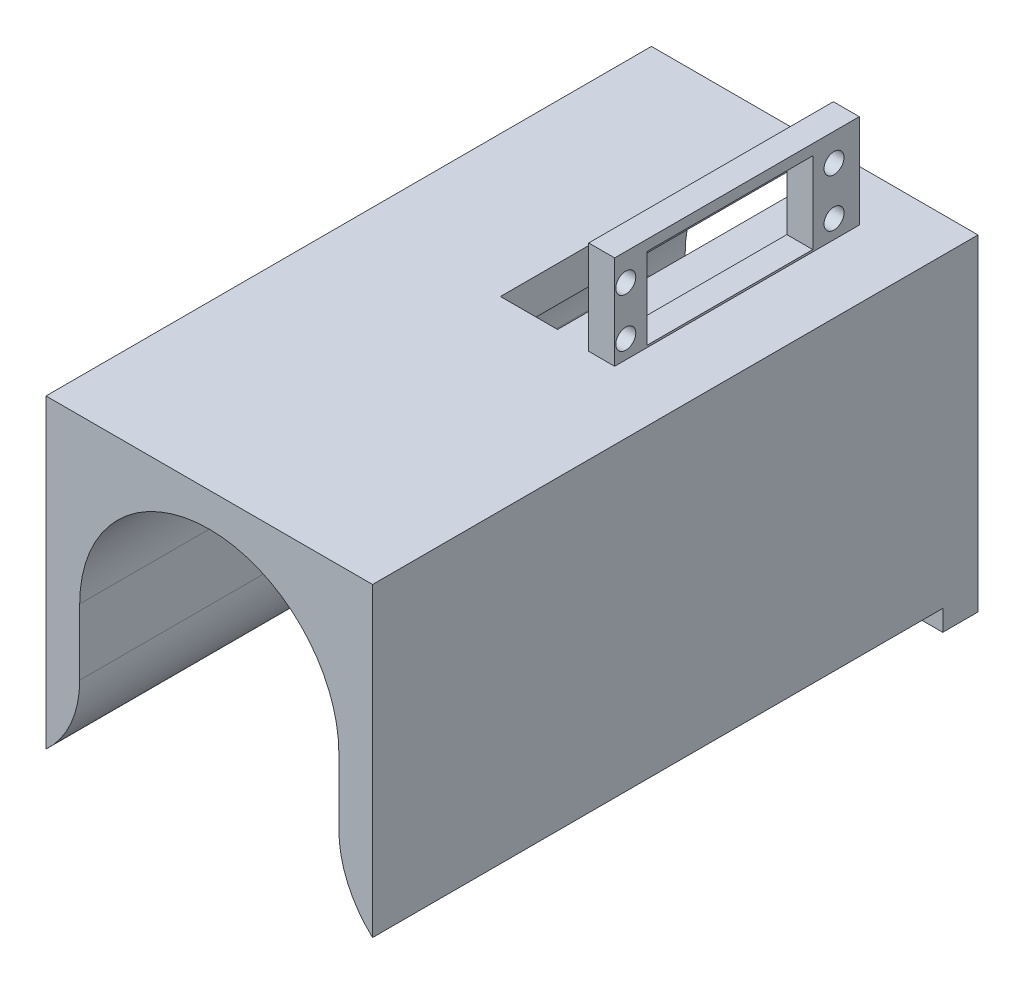
from build123d import *

# Parameters (mm, degrees)
SKETCH1_W           = 80.01
SKETCH1_H           = 80.01
BOSS_EXTRUDE1_DEPTH = 2.54
SKETCH2_W           = 80.01
SKETCH2_H           = 80.01
SKETCH2_W_2         = 69.85
SKETCH2_H_2         = 69.85
BOSS_EXTRUDE2_DEPTH = 145.796
SKETCH3_R           = 31.75
CUT_EXTRUDE1_DEPTH  = 69.85
SKETCH5_W           = 80.01
SKETCH5_H           = 139.7
CUT_EXTRUDE3_DEPTH  = 5.08
SKETCH6_W           = 69.85
SKETCH6_H           = 69.85
SKETCH6_R           = 31.75
BOSS_EXTRUDE3_DEPTH = 145.796
CUT_EXTRUDE5_START  = -139.7
CUT_EXTRUDE5_DEPTH  = 139.7
FILLET2_R           = 25.4
SKETCH9_W           = 6.35
SKETCH9_H           = 59.944
BOSS_EXTRUDE5_DEPTH = 23
SKETCH10_R          = 2.45
SKETCH10_W          = 40.6
SKETCH10_H          = 19.9
CUT_EXTRUDE7_DEPTH  = 23
SKETCH12_W          = 14
SKETCH12_H          = 72
CUT_EXTRUDE10_DEPTH = 24.13


with BuildPart() as part:
    # Sketch1 → Boss-Extrude1 (new body)
    with BuildSketch(Plane.XY):
        Rectangle(SKETCH1_W, SKETCH1_H)
    extrude(amount=BOSS_EXTRUDE1_DEPTH)

    # Sketch2 → Boss-Extrude2 (add)
    with BuildSketch(Plane.XY.offset(2.54)):
        Rectangle(SKETCH2_W, SKETCH2_H)
        Rectangle(SKETCH2_W_2, SKETCH2_H_2, mode=Mode.SUBTRACT)
    extrude(amount=BOSS_EXTRUDE2_DEPTH)

    # Sketch3 → Cut-Extrude1 (cut)
    with BuildSketch(Plane(origin=(0, 0, 0), x_dir=(-1, 0, 0), z_dir=(0, 0, -1))):
        Circle(SKETCH3_R)
    extrude(amount=-CUT_EXTRUDE1_DEPTH, mode=Mode.SUBTRACT)

    # Sketch5 → Cut-Extrude3 (cut)
    with BuildSketch(Plane.XZ.offset(40.005)):
        with Locations((0, 78.486)):
            Rectangle(SKETCH5_W, SKETCH5_H)
    extrude(amount=-CUT_EXTRUDE3_DEPTH, mode=Mode.SUBTRACT)

    # Sketch6 → Boss-Extrude3 (add)
    with BuildSketch(Plane.XY.offset(2.54)):
        Rectangle(SKETCH6_W, SKETCH6_H)
        with Locations(Location((0, 0, 0), (0, 0, 180))):
            Circle(SKETCH6_R, mode=Mode.SUBTRACT)
    extrude(amount=BOSS_EXTRUDE3_DEPTH)

    # Sketch8 → Cut-Extrude5 (cut)
    with BuildSketch(Plane.XY.offset(148.336).offset(CUT_EXTRUDE5_START)):
        with BuildLine():
            ThreePointArc((31.75, 0), (0, -31.75), (-31.75, 0))
            Line((-31.75, 0), (-31.75, -34.925))
            Line((-31.75, -34.925), (31.75, -34.925))
            Line((31.75, -34.925), (31.75, 0))
        make_face()
    extrude(amount=CUT_EXTRUDE5_DEPTH, mode=Mode.SUBTRACT)

    # Fillet2
    # the kernel refuses this fillet: 25.4 mm, written as the material it takes off along each edge
    with BuildSketch(Plane(origin=(31.75, -34.925, 8.636), x_dir=(1, 0, 0), z_dir=(0, 0, 1))) as fillet2_piece_1:
        with BuildLine():
            CenterArc((25.4, 18.740570295), FILLET2_R, 180, 47.545849796)
            Line((0, 18.740570295), (0, 0))
            Line((0, 0), (8.255, 0))
        make_face()
    extrude(amount=186.551425739, mode=Mode.SUBTRACT)
    with BuildSketch(Plane(origin=(-31.75, -34.925, 8.636), x_dir=(0, 1, 0), z_dir=(0, 0, 1))) as fillet2_piece_2:
        with BuildLine():
            CenterArc((18.740570295, 25.4), FILLET2_R, 222.454150204, 47.545849796)
            Line((0, 8.255), (0, 0))
            Line((0, 0), (18.740570295, 0))
        make_face()
    extrude(amount=186.551425739, mode=Mode.SUBTRACT)

    # Sketch9 → Boss-Extrude5 (add)
    with BuildSketch(Plane(origin=(0, 40.005, 0), x_dir=(1, 0, 0), z_dir=(0, 1, 0))):
        with Locations((20.193, -42.418)):
            Rectangle(SKETCH9_W, SKETCH9_H)
    extrude(amount=BOSS_EXTRUDE5_DEPTH)

    # Sketch10 → Cut-Extrude7 (cut)
    with BuildSketch(Plane(origin=(23.368, 0, 0), x_dir=(0, 0, -1), z_dir=(1, 0, 0))):
        with Locations((-69.659214709, 44.502596375)):
            Circle(SKETCH10_R)
        with Locations((-69.659214709, 56.402596375)):
            Circle(SKETCH10_R)
        with Locations((-18.639214709, 44.502596375)):
            Circle(SKETCH10_R)
        with Locations((-18.639214709, 56.244452771)):
            Circle(SKETCH10_R)
        with Locations((-44.149214709, 50.452596375)):
            Rectangle(SKETCH10_W, SKETCH10_H)
    extrude(amount=-CUT_EXTRUDE7_DEPTH, mode=Mode.SUBTRACT)

    # Sketch12 → Cut-Extrude10 (cut)
    with BuildSketch(Plane(origin=(0, 40.005, 0), x_dir=(1, 0, 0), z_dir=(0, 1, 0))):
        with Locations((1.568, -35.570235268)):
            Rectangle(SKETCH12_W, SKETCH12_H)
    extrude(amount=-CUT_EXTRUDE10_DEPTH, mode=Mode.SUBTRACT)


solid = part.part
